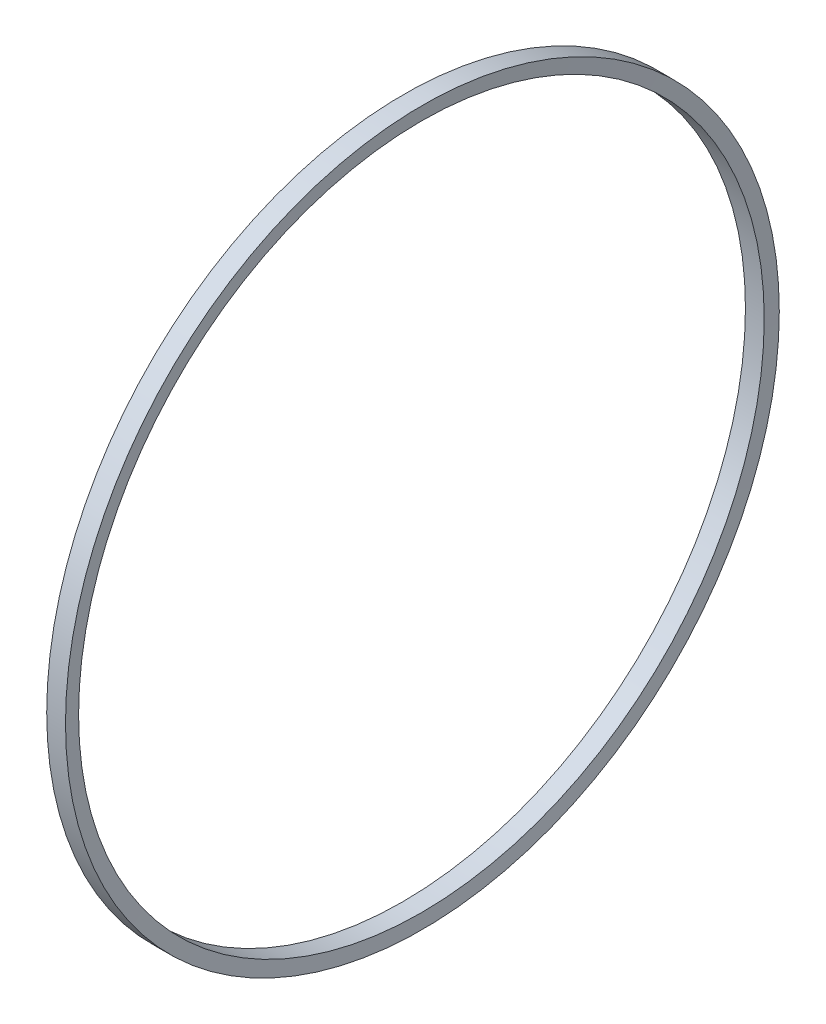
from build123d import *


with BuildPart() as part:
    # Skica2 → Rotovat1 (revolve)
    with BuildSketch(Plane.XY):
        Polygon((-15.678928865, 38), (-17.678928865, 38), (-17.783819083, 36.5), (-15.783819083, 36.5), align=None)
    revolve(axis=Axis((0, 0, 0), (-1, 0, 0)))


solid = part.part
